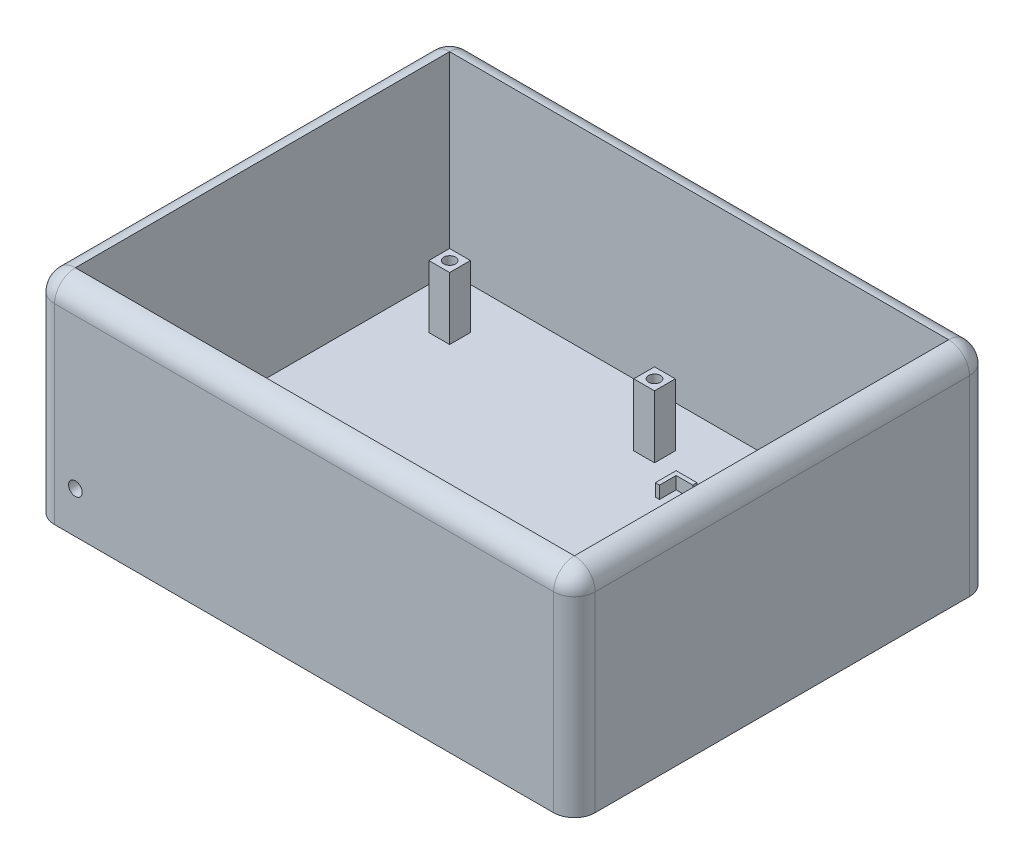
from build123d import *

# Parameters (mm, degrees)
SKETCH1_W                                         = 130
SKETCH1_H                                         = 100
BOSS_EXTRUDE1_DEPTH                               = 51
SKETCH2_W                                         = 120
SKETCH2_H                                         = 90
CUT_EXTRUDE1_DEPTH                                = 46
FILLET2_R                                         = 5
FILLET4_R                                         = 5
SKETCH6_W                                         = 5
SKETCH6_H                                         = 5
BOSS_EXTRUDE2_DEPTH                               = 15
BOSS_EXTRUDE3_DEPTH                               = 3
F_4_CLEARANCE_HOLE2_D                             = 2.8448
F_4_CLEARANCE_HOLE2_DEPTH                         = 10
CSK_FOR_4_FLAT_HEAD_MACHINE_SCREW_100_D           = 3.2639
CSK_FOR_4_FLAT_HEAD_MACHINE_SCREW_100_DEPTH       = 10
CSK_FOR_4_FLAT_HEAD_MACHINE_SCREW_100_CSINK_D     = 5.715
CSK_FOR_4_FLAT_HEAD_MACHINE_SCREW_100_CSINK_ANGLE = 100
CSK_FOR_4_FLAT_HEAD_MACHINE_SCREW_100_TIP         = 0.980574487
CSK_FOR_4_FLAT_HEAD_MACHINE_SCREW_2_D             = 3.2639
CSK_FOR_4_FLAT_HEAD_MACHINE_SCREW_2_DEPTH         = 10
CSK_FOR_4_FLAT_HEAD_MACHINE_SCREW_2_CSINK_D       = 5.715
CSK_FOR_4_FLAT_HEAD_MACHINE_SCREW_2_CSINK_ANGLE   = 100
CSK_FOR_4_FLAT_HEAD_MACHINE_SCREW_2_TIP           = 0.980574487


# Some blends are built 0.0001 mm under size
with BuildPart() as part:
    # Sketch1 → Boss-Extrude1 (new body)
    with BuildSketch(Plane(origin=(0, 0, 0), x_dir=(1, 0, 0), z_dir=(0, 1, 0))):
        Rectangle(SKETCH1_W, SKETCH1_H)
    extrude(amount=BOSS_EXTRUDE1_DEPTH)

    # Sketch2 → Cut-Extrude1 (cut)
    with BuildSketch(Plane(origin=(0, 51, 0), x_dir=(1, 0, 0), z_dir=(0, 1, 0))):
        Rectangle(SKETCH2_W, SKETCH2_H)
    extrude(amount=-CUT_EXTRUDE1_DEPTH, mode=Mode.SUBTRACT)

    # Fillet2
    fillet2_edges = [part.edges().sort_by_distance(p)[0] for p in [
        (-65, 51, 0),
        (0, 51, 50),
        (65, 51, 0),
        (0, 51, -50),
    ]]
    fillet(fillet2_edges, radius=FILLET2_R - 0.0001)  # a hair under: the kernel refuses the full size

    # Fillet4
    # the kernel refuses this fillet: 5 mm, written as the material it takes off along each edge
    with BuildSketch(Plane(origin=(60, 51, 45), x_dir=(0, 0, 1), z_dir=(-1, 0, 0))) as fillet4_piece_1:
        with BuildLine():
            CenterArc((0.0001, -4.9999), 4.9999, 0, 90)
            Line((5, -4.9999), (5, 0))
            Line((5, 0), (0.0001, 0))
        make_face()
    revolve(axis=Axis((60, 51, 45), (0, 1, 0)), revolution_arc=90, mode=Mode.SUBTRACT)
    with BuildSketch(Plane(origin=(-60, 51, 45), x_dir=(-1, 0, 0), z_dir=(0, 0, -1))) as fillet4_piece_2:
        with BuildLine():
            CenterArc((0.0001, -4.9999), 4.9999, 0, 90)
            Line((5, -4.9999), (5, 0))
            Line((5, 0), (0.0001, 0))
        make_face()
    revolve(axis=Axis((-60, 51, 45), (0, 1, 0)), revolution_arc=90, mode=Mode.SUBTRACT)
    with BuildSketch(Plane(origin=(60, 51, -45), x_dir=(1, 0, 0), z_dir=(0, 0, 1))) as fillet4_piece_3:
        with BuildLine():
            CenterArc((0.0001, -4.9999), 4.9999, 0, 90)
            Line((5, -4.9999), (5, 0))
            Line((5, 0), (0.0001, 0))
        make_face()
    revolve(axis=Axis((60, 51, -45), (0, 1, 0)), revolution_arc=90, mode=Mode.SUBTRACT)
    with BuildSketch(Plane(origin=(-60, 51, -45), x_dir=(0, 0, -1), z_dir=(1, 0, 0))) as fillet4_piece_4:
        with BuildLine():
            CenterArc((0.0001, -4.9999), 4.9999, 0, 90)
            Line((5, -4.9999), (5, 0))
            Line((5, 0), (0.0001, 0))
        make_face()
    revolve(axis=Axis((-60, 51, -45), (0, 1, 0)), revolution_arc=90, mode=Mode.SUBTRACT)
    with BuildSketch(Plane(origin=(-65, -12.5, -50), x_dir=(1, 0, 0), z_dir=(0, 1, 0)), Plane(origin=(-65, -12.5, 50), x_dir=(0, 0, -1), z_dir=(0, 1, 0))) as fillet4_piece_5:
        with BuildLine():
            CenterArc((FILLET4_R, -FILLET4_R), FILLET4_R, 90, 90)
            Line((0, -FILLET4_R), (0, 0))
            Line((0, 0), (FILLET4_R, 0))
        make_face()
    extrude(amount=63.5, mode=Mode.SUBTRACT)
    with BuildSketch(Plane(origin=(65, -12.5, -50), x_dir=(-1, 0, 0), z_dir=(0, 1, 0)), Plane(origin=(65, -12.5, 50), x_dir=(0, 0, -1), z_dir=(0, 1, 0))) as fillet4_piece_6:
        with BuildLine():
            CenterArc((FILLET4_R, FILLET4_R), FILLET4_R, 180, 90)
            Line((0, FILLET4_R), (0, 0))
            Line((0, 0), (FILLET4_R, 0))
        make_face()
    extrude(amount=63.5, mode=Mode.SUBTRACT)

    # Sketch6 → Boss-Extrude2 (add)
    with BuildSketch(Plane(origin=(0, 5, 0), x_dir=(1, 0, 0), z_dir=(0, 1, 0))):
        with Locations((-47.5, 32.5)):
            Rectangle(SKETCH6_W, SKETCH6_H)
        with Locations((-47.5, -31.53)):
            Rectangle(SKETCH6_W, SKETCH6_H)
        with Locations((1.77, 32.5)):
            Rectangle(SKETCH6_W, SKETCH6_H)
        with Locations((1.77, -31.53)):
            Rectangle(SKETCH6_W, SKETCH6_H)
    extrude(amount=BOSS_EXTRUDE2_DEPTH)

    # Sketch9 → Boss-Extrude3 (add)
    with BuildSketch(Plane(origin=(0, 5, 0), x_dir=(1, 0, 0), z_dir=(0, 1, 0))):
        Polygon((11.5, -14.03), (11.5, -19.03), (16.5, -19.03), (16.5, -18.03), (12.5, -18.03), (12.5, -14.03), align=None)
        Polygon((11.5, 27.97), (16.5, 27.97), (16.5, 26.97), (12.5, 26.97), (12.5, 22.97), (11.5, 22.97), align=None)
        Polygon((40, 27.97), (40, 22.97), (39, 22.97), (39, 26.97), (35, 26.97), (35, 27.97), align=None)
        Polygon((40, -19.03), (35, -19.03), (35, -18.03), (39, -18.03), (39, -14.03), (40, -14.03), align=None)
    extrude(amount=BOSS_EXTRUDE3_DEPTH)

    # #4 Clearance Hole2
    with Locations(Plane(origin=(58.965440854, 20, -19.145321972), x_dir=(1, 0, 0), z_dir=(0, 1, 0))):
        with Locations((-106.465440854, -50.675321972), (-57.195440854, -50.675321972), (-57.195440854, 13.354678028), (-106.465440854, 13.354678028)):
            Hole(F_4_CLEARANCE_HOLE2_D / 2, depth=F_4_CLEARANCE_HOLE2_DEPTH)

    # CSK for _4 Flat Head Machine Screw _100
    with Locations(Plane(origin=(58.965440854, 7.381222334, 55), x_dir=(1, 0, 0), z_dir=(0, 0, 1))):
        with Locations((-113.965440854, 2.618777666)):
            CounterSinkHole(CSK_FOR_4_FLAT_HEAD_MACHINE_SCREW_100_D / 2, CSK_FOR_4_FLAT_HEAD_MACHINE_SCREW_100_CSINK_D / 2, depth=CSK_FOR_4_FLAT_HEAD_MACHINE_SCREW_100_DEPTH, counter_sink_angle=CSK_FOR_4_FLAT_HEAD_MACHINE_SCREW_100_CSINK_ANGLE)
            with Locations((0, 0, -(CSK_FOR_4_FLAT_HEAD_MACHINE_SCREW_100_DEPTH + CSK_FOR_4_FLAT_HEAD_MACHINE_SCREW_100_TIP / 2))):  # 118° drill point
                Cone(0, CSK_FOR_4_FLAT_HEAD_MACHINE_SCREW_100_D / 2, CSK_FOR_4_FLAT_HEAD_MACHINE_SCREW_100_TIP, mode=Mode.SUBTRACT)

    # CSK for _4 Flat Head Machine Screw _ 2
    with Locations(Plane(origin=(58.965440854, 7.381222334, -55), x_dir=(-1, 0, 0), z_dir=(0, 0, -1))):
        with Locations((3.965440854, 2.618777666)):
            CounterSinkHole(CSK_FOR_4_FLAT_HEAD_MACHINE_SCREW_2_D / 2, CSK_FOR_4_FLAT_HEAD_MACHINE_SCREW_2_CSINK_D / 2, depth=CSK_FOR_4_FLAT_HEAD_MACHINE_SCREW_2_DEPTH, counter_sink_angle=CSK_FOR_4_FLAT_HEAD_MACHINE_SCREW_2_CSINK_ANGLE)
            with Locations((0, 0, -(CSK_FOR_4_FLAT_HEAD_MACHINE_SCREW_2_DEPTH + CSK_FOR_4_FLAT_HEAD_MACHINE_SCREW_2_TIP / 2))):  # 118° drill point
                Cone(0, CSK_FOR_4_FLAT_HEAD_MACHINE_SCREW_2_D / 2, CSK_FOR_4_FLAT_HEAD_MACHINE_SCREW_2_TIP, mode=Mode.SUBTRACT)


solid = part.part
